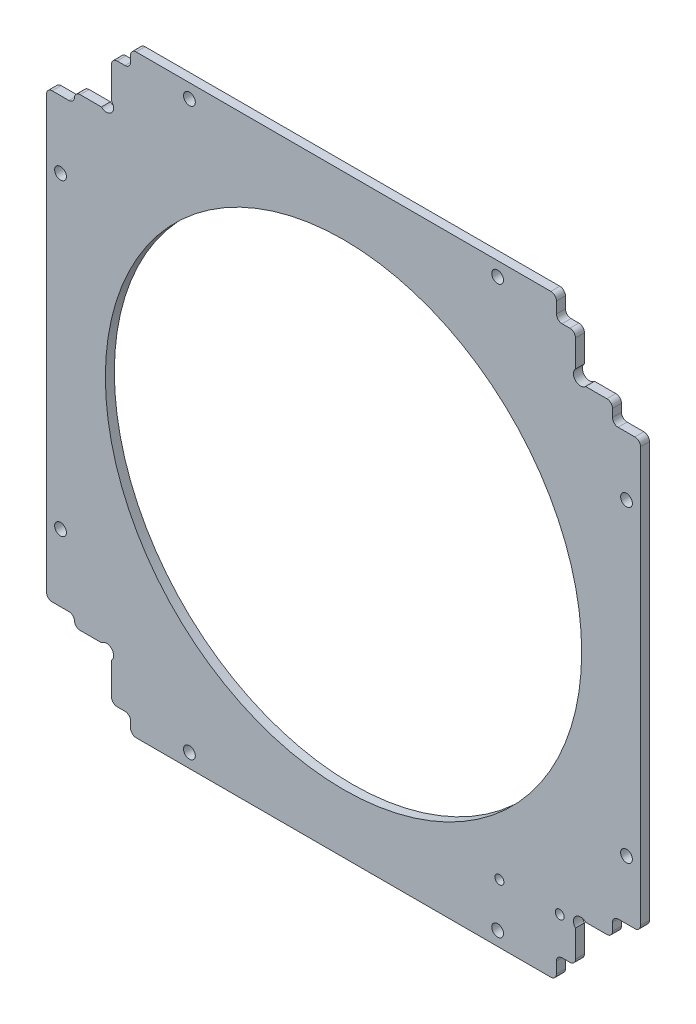
from build123d import *

# Parameters (mm, degrees)
SKETCH1_W               = 106
SKETCH1_H               = 106
MAINOUTLINE_DEPTH       = 1.6
RAILCUTOUTS_DEPTH       = 75.970394157
DOGBONES_DEPTH          = 75.970394157
SOLARFILLETS_DEPTH      = 75.970394157
HANDLINGFILLETS_R       = 1
M2_CLEARANCE_HOLE1_D    = 2.1
CUT_EXTRUDE1_DEPTH      = 75.9703943
CUT_EXTRUDE1_DEPTH_BACK = 75.9703943
SKETCH10_R              = 42.5
CUT_EXTRUDE3_DEPTH      = 75.9703943
CUT_EXTRUDE3_DEPTH_BACK = 75.9703943
SKETCH12_R              = 0.8


with BuildPart() as part:
    # Sketch1 → mainOutline (new body)
    with BuildSketch(Plane.XY):
        Rectangle(SKETCH1_W, SKETCH1_H)
    extrude(amount=MAINOUTLINE_DEPTH)

    # Sketch4 → railCutouts (cut, through all)
    with BuildSketch(Plane(origin=(0, 0, 0), x_dir=(-1, 0, 0), z_dir=(0, 0, -1))):
        Polygon((-41.4, -41.4), (-48, -41.4), (-48, -39), (-49.9975, -39), (-60.106513243, -39), (-60.106513243, -61.452099286), (-39, -61.452099286), (-39, -49.9), (-39, -49), (-41.4, -49), align=None)
        Polygon((39, -56.27525328), (39, -49.9), (41.4, -49.9), (41.4, -41.4), (48, -41.4), (48, -40.5), (55.517672261, -40.5), (55.517672261, -56.27525328), align=None)
        Polygon((55.383846757, 40.5), (48, 40.5), (48, 41.4), (41.4, 41.4), (41.4, 49.9), (39, 49.9), (39, 57.687687567), (55.383846757, 57.687687567), align=None)
        Polygon((-39, 59.880423019), (-39, 49.9), (-39, 49), (-41.4, 49), (-41.4, 41.4), (-48, 41.4), (-48, 39), (-49.9975, 39), (-56.842822937, 39), (-56.842822937, 59.880423019), align=None)
    extrude(amount=-RAILCUTOUTS_DEPTH, mode=Mode.SUBTRACT)

    # Sketch5 → dogbones (cut, through all)
    with BuildSketch(Plane(origin=(0, 0, 0), x_dir=(-1, 0, 0), z_dir=(0, 0, -1))):
        with BuildLine():
            Line((-41.4, -43.196051224), (-44.546497129, -46.342548353))
            ThreePointArc((-44.546497129, -46.342548353), (-46.342548353, -46.342548353), (-46.342548353, -44.546497129))
            Line((-46.342548353, -44.546497129), (-43.196051224, -41.4))
            ThreePointArc((-43.196051224, -41.4), (-41.4, -41.4), (-41.4, -43.196051224))
        make_face()
        with BuildLine():
            Line((43.196051224, -41.4), (44.93821772, -43.142166495))
            ThreePointArc((44.93821772, -43.142166495), (44.93821772, -44.93821772), (43.142166495, -44.93821772))
            Line((43.142166495, -44.93821772), (41.4, -43.196051224))
            ThreePointArc((41.4, -43.196051224), (41.4, -41.4), (43.196051224, -41.4))
        make_face()
        with BuildLine():
            Line((41.4, 43.196051224), (43.13099025, 44.927041474))
            ThreePointArc((43.13099025, 44.927041474), (44.927041474, 44.927041474), (44.927041474, 43.13099025))
            Line((44.927041474, 43.13099025), (43.196051224, 41.4))
            ThreePointArc((43.196051224, 41.4), (41.4, 41.4), (41.4, 43.196051224))
        make_face()
        with BuildLine():
            Line((-43.196051224, 41.4), (-44.694846249, 42.898795025))
            ThreePointArc((-44.694846249, 42.898795025), (-44.694846249, 44.694846249), (-42.898795025, 44.694846249))
            Line((-42.898795025, 44.694846249), (-41.4, 43.196051224))
            ThreePointArc((-41.4, 43.196051224), (-41.4, 41.4), (-43.196051224, 41.4))
        make_face()
    extrude(amount=-DOGBONES_DEPTH, mode=Mode.SUBTRACT)

    # Sketch6 → solarFillets (cut, through all)
    with BuildSketch(Plane(origin=(0, 0, 0), x_dir=(-1, 0, 0), z_dir=(0, 0, -1))):
        with BuildLine():
            Line((-40, 50), (-40, 53))
            ThreePointArc((-40, 53), (-39, 54), (-38, 53))
            Line((-38, 53), (-38, 50))
            ThreePointArc((-38, 50), (-39, 49), (-40, 50))
        make_face()
        with BuildLine():
            Line((-49, 38), (-53, 38))
            ThreePointArc((-53, 38), (-54, 39), (-53, 40))
            Line((-53, 40), (-49, 40))
            ThreePointArc((-49, 40), (-48, 39), (-49, 38))
        make_face()
        with BuildLine():
            Line((-49, -40), (-55.214202913, -40))
            ThreePointArc((-55.214202913, -40), (-56.214202913, -39), (-55.214202913, -38))
            Line((-55.214202913, -38), (-49, -38))
            ThreePointArc((-49, -38), (-48, -39), (-49, -40))
        make_face()
        with BuildLine():
            Line((-38, -50), (-38, -53.916094318))
            ThreePointArc((-38, -53.916094318), (-39, -54.916094318), (-40, -53.916094318))
            Line((-40, -53.916094318), (-40, -50))
            ThreePointArc((-40, -50), (-39, -49), (-38, -50))
        make_face()
        with BuildLine():
            Line((40, -50.9), (40, -54.538013421))
            ThreePointArc((40, -54.538013421), (39, -55.538013421), (38, -54.538013421))
            Line((38, -54.538013421), (38, -50.9))
            ThreePointArc((38, -50.9), (39, -49.9), (40, -50.9))
        make_face()
        with BuildLine():
            Line((49, -39.5), (54.202622605, -39.5))
            ThreePointArc((54.202622605, -39.5), (55.202622605, -40.5), (54.202622605, -41.5))
            Line((54.202622605, -41.5), (49, -41.5))
            ThreePointArc((49, -41.5), (48, -40.5), (49, -39.5))
        make_face()
        with BuildLine():
            Line((49, 41.5), (54.556563772, 41.5))
            ThreePointArc((54.556563772, 41.5), (55.556563772, 40.5), (54.556563772, 39.5))
            Line((54.556563772, 39.5), (49, 39.5))
            ThreePointArc((49, 39.5), (48, 40.5), (49, 41.5))
        make_face()
        with BuildLine():
            Line((38, 50.9), (38, 55.828092709))
            ThreePointArc((38, 55.828092709), (39, 56.828092709), (40, 55.828092709))
            Line((40, 55.828092709), (40, 50.9))
            ThreePointArc((40, 50.9), (39, 49.9), (38, 50.9))
        make_face()
    extrude(amount=-SOLARFILLETS_DEPTH, mode=Mode.SUBTRACT)

    # handlingFillets
    handlingfillets_edges = [part.edges().sort_by_distance(p)[0] for p in [
        (-41.4, -49.9, 0.8),
        (-38, -53, 0.8),
        (-53, -39.5, 0.8),
        (-48, -41.4, 0.8),
        (-48, 41.4, 0.8),
        (-53, 39.5, 0.8),
        (-41.4, 49.9, 0.8),
        (-38, 53, 0.8),
        (38, 53, 0.8),
        (41.4, 49, 0.8),
        (48, 41.4, 0.8),
        (53, 38, 0.8),
        (53, -38, 0.8),
        (48, -41.4, 0.8),
        (41.4, -49, 0.8),
        (38, -53, 0.8),
    ]]
    fillet(handlingfillets_edges, radius=HANDLINGFILLETS_R)

    # M2 Clearance Hole1 (through all)
    with Locations(Plane(origin=(0, 0, 0), x_dir=(-1, 0, 0), z_dir=(0, 0, -1))):
        with Locations((50.5, -27.5), (27.5, -50.5), (-50.5, -27.5), (-27.5, -50.5), (-27.5, 50.5), (-50.5, 27.5), (27.5, 50.5), (50.5, 27.5)):
            Hole(M2_CLEARANCE_HOLE1_D / 2)

    # Sketch10 → Cut-Extrude1 (cut, two sides: drawn at the far end of the back side and taken through both)
    with BuildSketch(Plane(origin=(0, 0, 0), x_dir=(-1, 0, 0), z_dir=(0, 0, -1)).offset(-CUT_EXTRUDE1_DEPTH_BACK)):
        Circle(SKETCH10_R)
    extrude(amount=CUT_EXTRUDE1_DEPTH + CUT_EXTRUDE1_DEPTH_BACK, mode=Mode.SUBTRACT)

    # Sketch12 → Cut-Extrude3 (cut, two sides: drawn at the far end of the back side and taken through both)
    with BuildSketch(Plane.XY.offset(1.6).offset(-CUT_EXTRUDE3_DEPTH_BACK)):
        with Locations((27.815, -42.5)):
            Circle(SKETCH12_R)
        with Locations((38.585, -42.5)):
            Circle(SKETCH12_R)
    extrude(amount=CUT_EXTRUDE3_DEPTH + CUT_EXTRUDE3_DEPTH_BACK, mode=Mode.SUBTRACT)


solid = part.part
